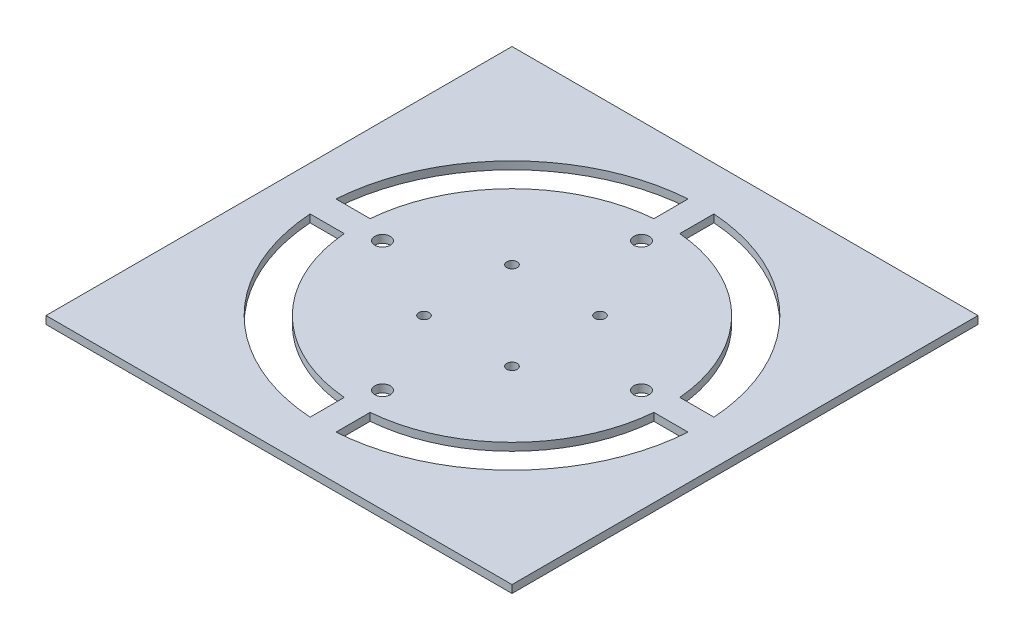
from build123d import *

# Parameters (mm, degrees)
SKETCH_1_W      = 90
SKETCH_1_H      = 90
SKETCH_1_R      = 1.5
SKETCH_1_R_2    = 1
EXTRUDE_1_DEPTH = 1.5


with BuildPart() as part:
    # 草图1 → 凸台-拉伸1 (new body)
    with BuildSketch(Plane(origin=(0, 0, 0), x_dir=(1, 0, 0), z_dir=(0, 1, 0))):
        Rectangle(SKETCH_1_W, SKETCH_1_H)
        with Locations((0, 25)):
            Circle(SKETCH_1_R, mode=Mode.SUBTRACT)
        with Locations((25, 0)):
            Circle(SKETCH_1_R, mode=Mode.SUBTRACT)
        with Locations((0, -25)):
            Circle(SKETCH_1_R, mode=Mode.SUBTRACT)
        with Locations((-25, 0)):
            Circle(SKETCH_1_R, mode=Mode.SUBTRACT)
        with Locations((8.5, 8.5)):
            Circle(SKETCH_1_R_2, mode=Mode.SUBTRACT)
        with Locations((-8.5, 8.5)):
            Circle(SKETCH_1_R_2, mode=Mode.SUBTRACT)
        with Locations((8.5, -8.5)):
            Circle(SKETCH_1_R_2, mode=Mode.SUBTRACT)
        with Locations((-8.5, -8.5)):
            Circle(SKETCH_1_R_2, mode=Mode.SUBTRACT)
        with BuildLine():
            Line((29.895651858, 2.5), (36.495651858, 2.5))
            ThreePointArc((36.495651858, 2.5), (25.866799227, 25.866799227), (2.5, 36.495651858))
            Line((2.5, 36.495651858), (2.5, 29.895651858))
            ThreePointArc((2.5, 29.895651858), (21.213203436, 21.213203436), (29.895651858, 2.5))
        make_face(mode=Mode.SUBTRACT)
        with BuildLine():
            Line((29.895651858, -2.5), (36.495651858, -2.5))
            ThreePointArc((36.495651858, -2.5), (25.866799227, -25.866799227), (2.5, -36.495651858))
            Line((2.5, -36.495651858), (2.5, -29.895651858))
            ThreePointArc((2.5, -29.895651858), (21.213203436, -21.213203436), (29.895651858, -2.5))
        make_face(mode=Mode.SUBTRACT)
        with BuildLine():
            Line((-2.5, 36.495651858), (-2.5, 29.895651858))
            ThreePointArc((-2.5, 29.895651858), (-21.213203436, 21.213203436), (-29.895651858, 2.5))
            Line((-29.895651858, 2.5), (-36.495651858, 2.5))
            ThreePointArc((-36.495651858, 2.5), (-25.866799227, 25.866799227), (-2.5, 36.495651858))
        make_face(mode=Mode.SUBTRACT)
        with BuildLine():
            Line((-2.5, -36.495651858), (-2.5, -29.895651858))
            ThreePointArc((-2.5, -29.895651858), (-21.213203436, -21.213203436), (-29.895651858, -2.5))
            Line((-29.895651858, -2.5), (-36.495651858, -2.5))
            ThreePointArc((-36.495651858, -2.5), (-25.866799227, -25.866799227), (-2.5, -36.495651858))
        make_face(mode=Mode.SUBTRACT)
    extrude(amount=EXTRUDE_1_DEPTH)


solid = part.part
